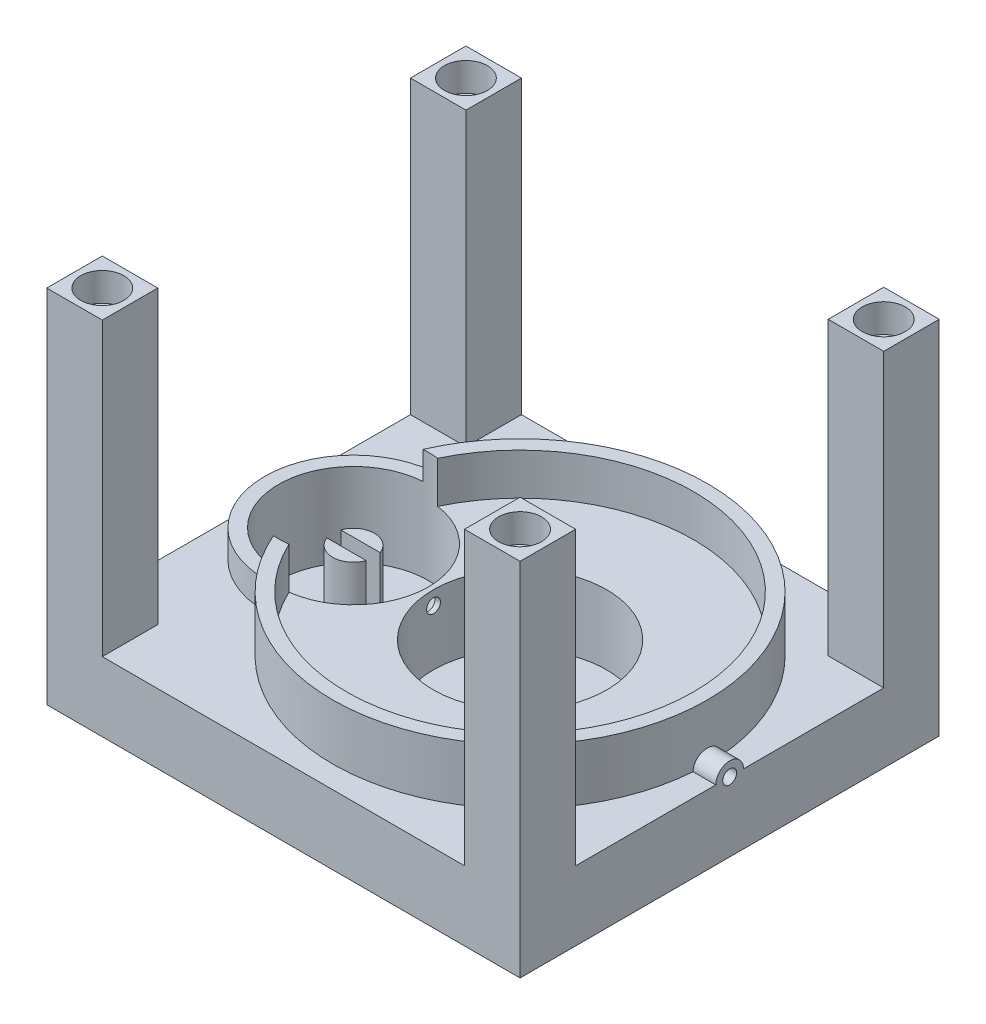
from build123d import *
from build123d.topology import SkipClean

# Parameters (mm, degrees)
SKETCH1_W               = 34.1
SKETCH1_H               = 30.2
BOSS_EXTRUDE1_DEPTH     = 5
SKETCH2_R               = 13.5
BOSS_EXTRUDE2_DEPTH     = 1
SKETCH3_R               = 13.5
SKETCH3_R_2             = 12.5
BOSS_EXTRUDE3_DEPTH     = 3
SKETCH4_R               = 6.25
CUT_EXTRUDE2_DEPTH      = 5
CUT_EXTRUDE3_DEPTH      = 5
CUT_EXTRUDE3_DEPTH_BACK = 5
SKETCH6_R               = 5.4
BOSS_EXTRUDE4_DEPTH     = 2
BOSS_EXTRUDE5_DEPTH     = 4.9
SKETCH10_R              = 1
SKETCH10_R_2            = 0.5
CUT_SWEEP1_START        = -34.728938274
CUT_SWEEP1_OUTLINE_R    = 0.5
CUT_SWEEP1_DEPTH        = 21.723198077
CUT_EXTRUDE4_START      = 5
SKETCH13_R              = 6.25
CUT_EXTRUDE4_DEPTH      = 5
SKETCH14_W              = 4
SKETCH14_H              = 4
BOSS_EXTRUDE6_DEPTH     = 21
SKETCH15_R              = 1.55
CUT_EXTRUDE5_DEPTH      = 2.05


# Read off the part's stored shape, not the designer's step: Cut-Sweep1
with BuildPart() as part:
    # Sketch1 → Boss-Extrude1 (new body)
    with BuildSketch(Plane(origin=(0, 0, 0), x_dir=(1, 0, 0), z_dir=(0, 1, 0))):
        with Locations((-30.055740197, -36.544574539)):
            Rectangle(SKETCH1_W, SKETCH1_H)
    extrude(amount=BOSS_EXTRUDE1_DEPTH)

    # Sketch2 → Boss-Extrude2 (add)
    with BuildSketch(Plane(origin=(0, 5, 0), x_dir=(1, 0, 0), z_dir=(0, 1, 0))):
        with Locations(Location((-28.105740197, -36.544574539, 0), (0, 0, 270))):
            Circle(SKETCH2_R)
    extrude(amount=BOSS_EXTRUDE2_DEPTH)

    # Sketch3 → Boss-Extrude3 (add)
    with BuildSketch(Plane(origin=(0, 6, 0), x_dir=(1, 0, 0), z_dir=(0, 1, 0))):
        with Locations(Location((-28.105740197, -36.544574539, 0), (0, 0, 270))):
            Circle(SKETCH3_R)
        with Locations(Location((-28.105740197, -36.544574539, 0), (0, 0, 270))):
            Circle(SKETCH3_R_2, mode=Mode.SUBTRACT)
    extrude(amount=BOSS_EXTRUDE3_DEPTH)

    # Sketch4 → Cut-Extrude2 (cut)
    with BuildSketch(Plane(origin=(0, 6, 0), x_dir=(1, 0, 0), z_dir=(0, 1, 0))):
        with Locations(Location((-28.105740197, -36.544574539, 0), (0, 0, 270))):
            Circle(SKETCH4_R)
    extrude(amount=-CUT_EXTRUDE2_DEPTH, mode=Mode.SUBTRACT)

    # Sketch6 → Cut-Extrude3 (cut, two sides: drawn at the far end of the back side and taken through both)
    with BuildSketch(Plane(origin=(0, 6, 0), x_dir=(1, 0, 0), z_dir=(0, 1, 0)).offset(-CUT_EXTRUDE3_DEPTH_BACK)):
        with Locations(Location((-40.105740197, -36.544574539, 0), (0, 0, 94.021964573))):
            Circle(SKETCH6_R)
    extrude(amount=CUT_EXTRUDE3_DEPTH + CUT_EXTRUDE3_DEPTH_BACK, mode=Mode.SUBTRACT)

    # Sketch7 → Boss-Extrude4 (add)
    with BuildSketch(Plane(origin=(0, 5, 0), x_dir=(1, 0, 0), z_dir=(0, 1, 0))):
        with BuildLine():
            ThreePointArc((-40.484490197, -41.931275611), (-45.505740197, -36.544574539), (-40.484490197, -31.157873467))
            ThreePointArc((-40.484490197, -31.157873467), (-40.249209884, -30.646596585), (-39.99282353, -30.145570724))
            ThreePointArc((-39.99282353, -30.145570724), (-46.505740197, -36.544574539), (-39.99282353, -42.943578354))
            ThreePointArc((-39.99282353, -42.943578354), (-40.249209884, -42.442552493), (-40.484490197, -41.931275611))
        make_face()
    extrude(amount=BOSS_EXTRUDE4_DEPTH)

    # Sketch9 → Boss-Extrude5 (add)
    with BuildSketch(Plane(origin=(0, 1, 0), x_dir=(1, 0, 0), z_dir=(0, 1, 0))):
        with BuildLine():
            Line((-38.691526635, -37.044574539), (-41.519953759, -37.044574539))
            ThreePointArc((-41.519953759, -37.044574539), (-40.105740197, -38.044574539), (-38.691526635, -37.044574539))
        make_face()
        with BuildLine():
            ThreePointArc((-38.691526635, -36.044574539), (-40.105740197, -35.044574539), (-41.519953759, -36.044574539))
            Line((-41.519953759, -36.044574539), (-38.691526635, -36.044574539))
        make_face()
    extrude(amount=BOSS_EXTRUDE5_DEPTH)

    # Sweep1: sweep along a path in Sketch11
    with BuildLine(Plane(origin=(0, 5, 0), x_dir=(1, 0, 0), z_dir=(0, 1, 0))) as sweep1_path:
        Line((-13.005740197, -36.544574539), (-34.705740197, -36.544574539))
    # Sketch10 → Sweep1 (sweep)
    with BuildSketch(Plane(origin=(-13.005740197, 0, 0), x_dir=(0, 0, -1), z_dir=(1, 0, 0))):
        with Locations((-36.544574539, 5)):
            Circle(SKETCH10_R)
        with Locations((-36.544574539, 5)):
            Circle(SKETCH10_R_2, mode=Mode.SUBTRACT)
    sweep(path=sweep1_path.line)

    # Cut-Sweep1 outline → Cut-Sweep1 (cut)
    with SkipClean():  # the faces are left unmerged after this step: merging them gives an invalid solid
        with BuildSketch(Plane.YZ.offset(CUT_SWEEP1_START)):
            with Locations((5, 36.544574539)):
                Circle(CUT_SWEEP1_OUTLINE_R)
        extrude(amount=CUT_SWEEP1_DEPTH, mode=Mode.SUBTRACT)
    add(part.part.scale(1), mode=Mode.REPLACE)  # the faces are merged on a copy

    # Sketch13 → Cut-Extrude4 (cut)
    with BuildSketch(Plane(origin=(0, 1, 0), x_dir=(1, 0, 0), z_dir=(0, 1, 0)).offset(CUT_EXTRUDE4_START)):
        with Locations(Location((-28.105740197, -36.544574539, 0), (0, 0, 270))):
            Circle(SKETCH13_R)
    extrude(amount=-CUT_EXTRUDE4_DEPTH, mode=Mode.SUBTRACT)

    # Sketch14 → Boss-Extrude6 (add)
    with BuildSketch(Plane(origin=(0, 5, 0), x_dir=(1, 0, 0), z_dir=(0, 1, 0))):
        with Locations((-45.105740197, -23.444574539)):
            Rectangle(SKETCH14_W, SKETCH14_H)
        with Locations((-45.105740197, -49.644574539)):
            Rectangle(SKETCH14_W, SKETCH14_H)
        with Locations((-15.005740197, -49.644574539)):
            Rectangle(SKETCH14_W, SKETCH14_H)
        with Locations((-15.005740197, -23.444574539)):
            Rectangle(SKETCH14_W, SKETCH14_H)
    extrude(amount=BOSS_EXTRUDE6_DEPTH)

    # Sketch15 → Cut-Extrude5 (cut)
    with BuildSketch(Plane(origin=(0, 26, 0), x_dir=(1, 0, 0), z_dir=(0, 1, 0))):
        with Locations(Location((-45.105740197, -49.644574539, 0), (0, 0, 270))):
            Circle(SKETCH15_R)
        with Locations(Location((-45.105740197, -23.444574539, 0), (0, 0, 270))):
            Circle(SKETCH15_R)
        with Locations(Location((-15.005740197, -23.444574539, 0), (0, 0, 270))):
            Circle(SKETCH15_R)
        with Locations(Location((-15.005740197, -49.644574539, 0), (0, 0, 270))):
            Circle(SKETCH15_R)
    extrude(amount=-CUT_EXTRUDE5_DEPTH, mode=Mode.SUBTRACT)


solid = part.part
